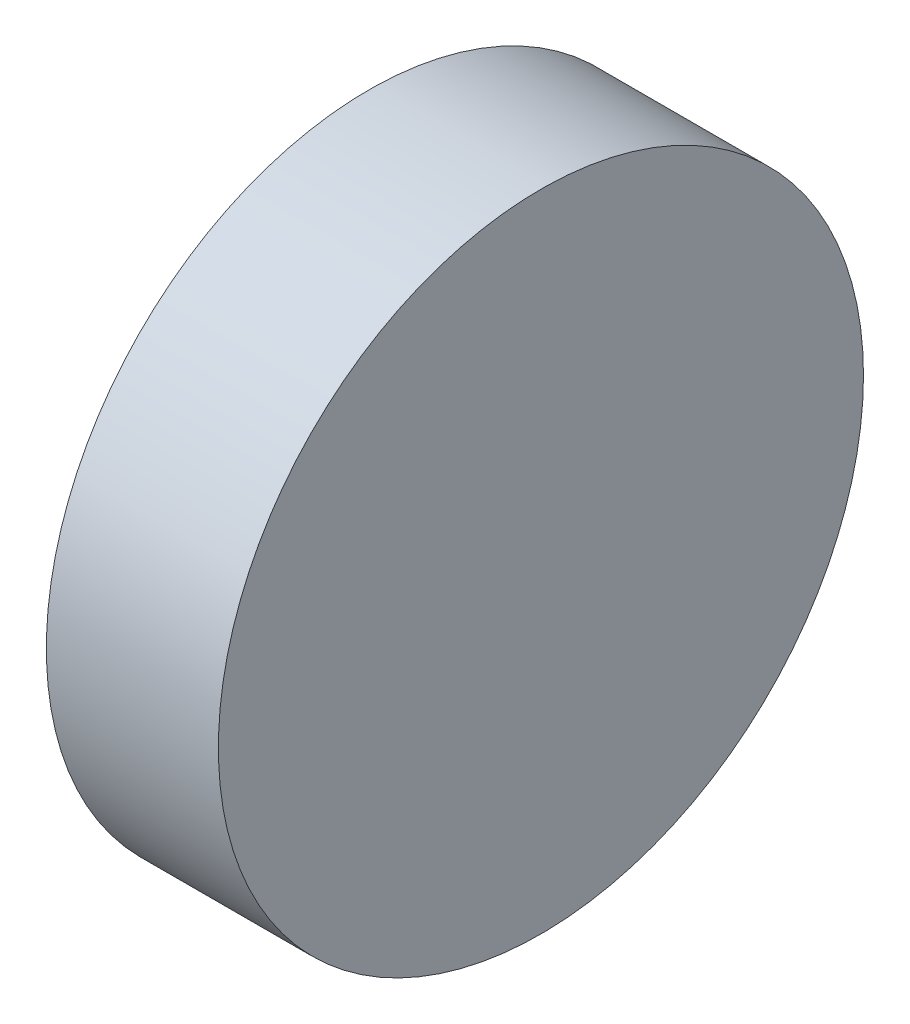
from build123d import *

# Parameters (mm, degrees)
SKETCH1_R           = 37.5
BOSS_EXTRUDE1_DEPTH = 20


with BuildPart() as part:
    # Sketch1 → Boss-Extrude1 (new body)
    with BuildSketch(Plane(origin=(0, 0, 0), x_dir=(0, 0, -1), z_dir=(1, 0, 0))):
        Circle(SKETCH1_R)
    extrude(amount=BOSS_EXTRUDE1_DEPTH)


solid = part.part
